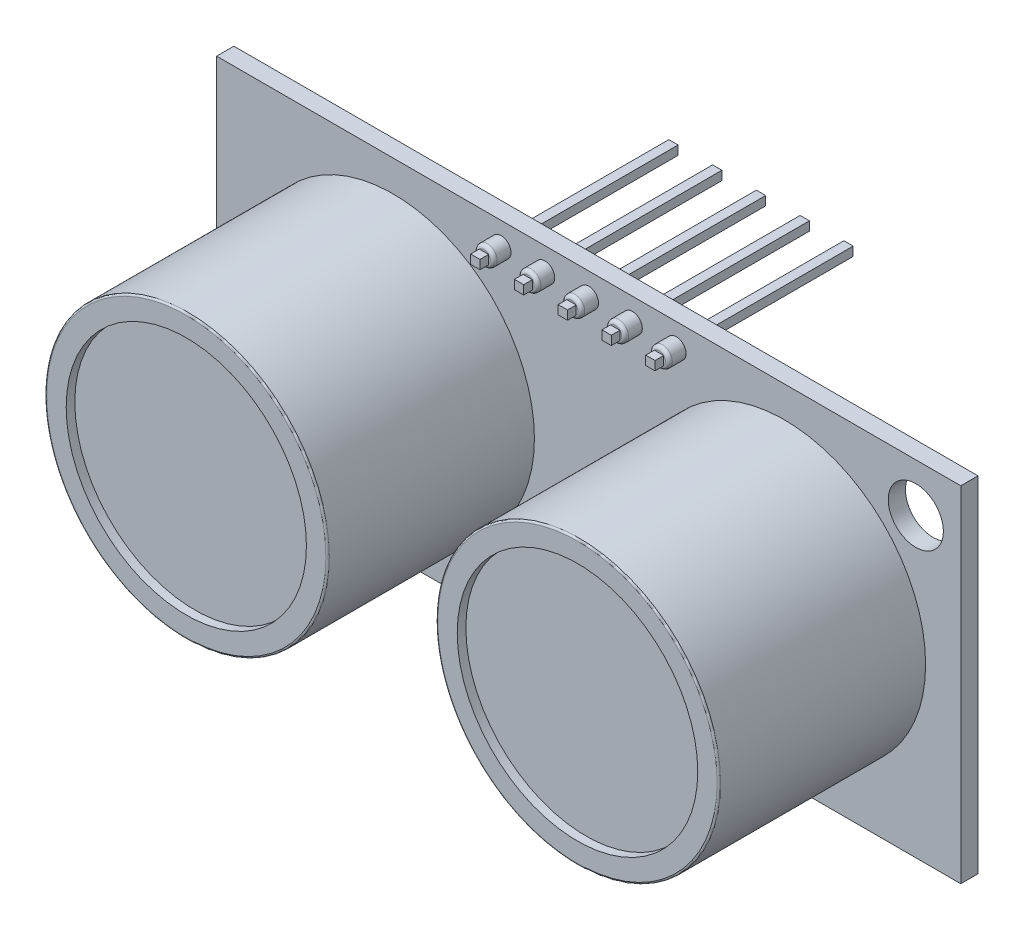
from build123d import *

# Parameters (mm, degrees)
SKETCH1_W           = 43.18
SKETCH1_H           = 20
SKETCH1_R           = 1.6
SKETCH1_R_2         = 1.538678099
EXTRUDE1_DEPTH      = 1
SKETCH2_R           = 8.2
EXTRUDE2_DEPTH      = 12
SKETCH3_R           = 6.969678997
SKETCH3_R_2         = 6.978435898
EXTRUDE3_DEPTH      = 0.5
FILLET1_R           = 0.1
EXTRUDE6_START      = -10
SKETCH6_W           = 0.539810115
SKETCH6_H           = 0.52170865
EXTRUDE6_DEPTH      = 11.5
SKETCH9_R           = 0.57049594
EXTRUDE11_DEPTH     = 1
FILLET2_R           = 0.2
FILLET3_R           = 0.2
LPATTERN6_COUNT     = 5
LPATTERN6_PITCH     = 2.54
SKETCH34_R          = 3
BOSS_EXTRUDE1_DEPTH = 5


with BuildPart() as part:
    # Sketch1 → Extrude1 (new body)
    with BuildSketch(Plane.XY):
        with Locations((-17.256684685, 18.92809066)):
            Rectangle(SKETCH1_W, SKETCH1_H)
        with Locations((1.723568211, 26.12809066)):
            Circle(SKETCH1_R, mode=Mode.SUBTRACT)
        with Locations((-36.236937581, 11.72809066)):
            Circle(SKETCH1_R_2, mode=Mode.SUBTRACT)
    extrude(amount=EXTRUDE1_DEPTH)

    # Sketch2 → Extrude2 (add)
    with BuildSketch(Plane.XY.offset(1)):
        with Locations((-28.606684685, 18.92809066)):
            Circle(SKETCH2_R)
        with Locations((-5.906684685, 18.92809066)):
            Circle(SKETCH2_R)
    extrude(amount=EXTRUDE2_DEPTH)

    # Sketch3 → Extrude3 (cut)
    with BuildSketch(Plane.XY.offset(13)):
        with Locations((-28.606684685, 18.92809066)):
            Circle(SKETCH3_R)
        with Locations((-5.906684685, 18.92809066)):
            Circle(SKETCH3_R_2)
    extrude(amount=-EXTRUDE3_DEPTH, mode=Mode.SUBTRACT)

    # Fillet1
    fillet1_edges = [part.edges().sort_by_distance(p)[0] for p in [
        (-36.806684685, 18.92809066, 13),
        (-14.106684685, 18.92809066, 13),
    ]]
    fillet(fillet1_edges, radius=FILLET1_R)

    # Sketch6 → Extrude6 (add)
    with BuildSketch(Plane.XY.offset(1).offset(EXTRUDE6_START)):
        with Locations((-22.336684684, 27.592837413)):
            Rectangle(SKETCH6_W, SKETCH6_H)
    extrude6 = extrude(amount=EXTRUDE6_DEPTH)

    # Sketch9 → Extrude11 (add)
    with BuildSketch(Plane.XY.offset(1)):
        with Locations((-22.336684685, 27.592892356)):
            Circle(SKETCH9_R)
        with Locations((-12.176684685, 27.592892356)):
            Circle(SKETCH9_R)
        with Locations((-14.716684685, 27.592892356)):
            Circle(SKETCH9_R)
        with Locations((-17.256684685, 27.592892356)):
            Circle(SKETCH9_R)
        with Locations((-19.796684685, 27.592892356)):
            Circle(SKETCH9_R)
    extrude(amount=EXTRUDE11_DEPTH)

    # Fillet2
    # the kernel refuses this fillet: 0.2 mm, written as the material it takes off along each edge
    with BuildSketch(Plane(origin=(-22.336684685, 27.592892356, 2), x_dir=(1, 0, 0), z_dir=(0, -1, 0))) as fillet2_piece_1_section:
        with BuildLine():
            CenterArc((0.57049594 - FILLET2_R, -FILLET2_R), FILLET2_R, 0, 90)
            Line((0.57049594 - FILLET2_R, 0), (0.57049594, 0))
            Line((0.57049594, 0), (0.57049594, -FILLET2_R))
        make_face()
    fillet2_piece_1 = revolve(axis=Axis((-22.336684685, 27.592892356, 2), (0, 0, 1)), mode=Mode.PRIVATE)
    fillet2_piece_1 = split(fillet2_piece_1, bisect_by=Plane(origin=(-22.066779627, 27.59283254, 1.955505058), z_dir=(1, 0, 0)), keep=Keep.TOP, mode=Mode.PRIVATE)
    add(fillet2_piece_1, mode=Mode.SUBTRACT)
    with BuildSketch(Plane(origin=(-22.336684685, 27.592892356, 2), x_dir=(1, 0, 0), z_dir=(0, -1, 0))) as fillet2_piece_2_section:
        with BuildLine():
            CenterArc((0.57049594 - FILLET2_R, -FILLET2_R), FILLET2_R, 0, 90)
            Line((0.57049594 - FILLET2_R, 0), (0.57049594, 0))
            Line((0.57049594, 0), (0.57049594, -FILLET2_R))
        make_face()
    fillet2_piece_2 = revolve(axis=Axis((-22.336684685, 27.592892356, 2), (0, 0, 1)), mode=Mode.PRIVATE)
    fillet2_piece_2 = split(fillet2_piece_2, bisect_by=Plane(origin=(-22.3366853, 27.853691738, 1.955521185), z_dir=(0, 1, 0)), keep=Keep.TOP, mode=Mode.PRIVATE)
    add(fillet2_piece_2, mode=Mode.SUBTRACT)
    with BuildSketch(Plane(origin=(-22.336684685, 27.592892356, 2), x_dir=(1, 0, 0), z_dir=(0, -1, 0))) as fillet2_piece_3_section:
        with BuildLine():
            CenterArc((0.57049594 - FILLET2_R, -FILLET2_R), FILLET2_R, 0, 90)
            Line((0.57049594 - FILLET2_R, 0), (0.57049594, 0))
            Line((0.57049594, 0), (0.57049594, -FILLET2_R))
        make_face()
    fillet2_piece_3 = revolve(axis=Axis((-22.336684685, 27.592892356, 2), (0, 0, 1)), mode=Mode.PRIVATE)
    fillet2_piece_3 = split(fillet2_piece_3, bisect_by=Plane(origin=(-22.33668407, 27.331983088, 1.955521185), z_dir=(0, -1, 0)), keep=Keep.TOP, mode=Mode.PRIVATE)
    add(fillet2_piece_3, mode=Mode.SUBTRACT)
    with BuildSketch(Plane(origin=(-22.336684685, 27.592892356, 2), x_dir=(1, 0, 0), z_dir=(0, -1, 0))) as fillet2_piece_4_section:
        with BuildLine():
            CenterArc((0.57049594 - FILLET2_R, -FILLET2_R), FILLET2_R, 0, 90)
            Line((0.57049594 - FILLET2_R, 0), (0.57049594, 0))
            Line((0.57049594, 0), (0.57049594, -FILLET2_R))
        make_face()
    fillet2_piece_4 = revolve(axis=Axis((-22.336684685, 27.592892356, 2), (0, 0, 1)), mode=Mode.PRIVATE)
    fillet2_piece_4 = split(fillet2_piece_4, bisect_by=Plane(origin=(-22.606589742, 27.592831126, 1.955504738), z_dir=(-1, 0, 0)), keep=Keep.TOP, mode=Mode.PRIVATE)
    add(fillet2_piece_4, mode=Mode.SUBTRACT)

    # Fillet3
    fillet3_edges = [part.edges().sort_by_distance(p)[0] for p in [
        (-20.367180625, 27.592892356, 2),
        (-17.827180625, 27.592892356, 2),
        (-15.287180625, 27.592892356, 2),
        (-12.747180625, 27.592892356, 2),
    ]]
    fillet(fillet3_edges, radius=FILLET3_R)

    # LPattern6: Extrude6 ×5
    with Locations(*[(i * LPATTERN6_PITCH, 0, 0) for i in range(1, LPATTERN6_COUNT)]):
        add(extrude6)

    # Sketch34 → Boss-Extrude1 (add)
    with BuildSketch(Plane.XY.offset(1)):
        with Locations((-17.256684685, 12.42809066)):
            Circle(SKETCH34_R)
    extrude(amount=BOSS_EXTRUDE1_DEPTH)


solid = part.part
